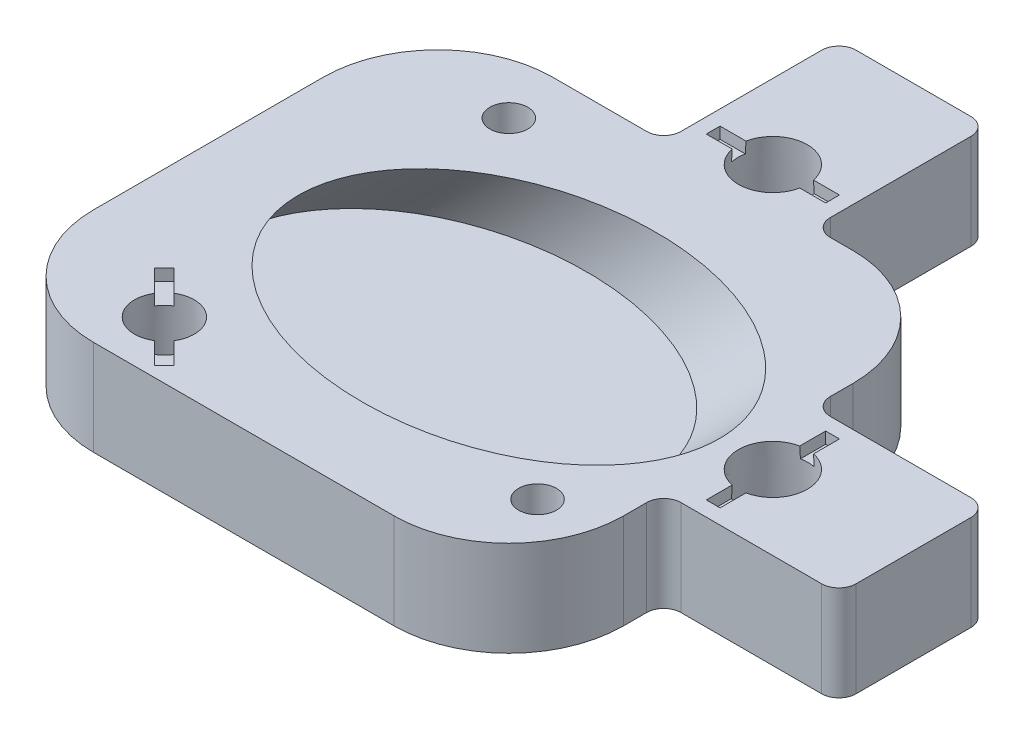
from build123d import *

# Parameters (mm, degrees)
SKETCH2_R           = 3
SKETCH2_R_2         = 2.6
SKETCH2_R_3         = 1.65
BOSS_EXTRUDE1_DEPTH = 8.3
SKETCH19_RX         = 18.35
SKETCH19_RY         = 12.8
CUT_EXTRUDE4_DEPTH  = 8.485281374
FILLET1_R           = 1.5
FILLET2_R           = 10
SKETCH14_W          = 1.2
SKETCH14_H          = 10.4
SKETCH14_W_2        = 10.4
SKETCH14_H_2        = 1.2
CUT_EXTRUDE2_DEPTH  = 1
CUT_EXTRUDE3_DEPTH  = 3.9
CHAMFER1_SIZE       = 0.5
CHAMFER1_SIZE_2     = 8.3
SKETCH20_W          = 7
SKETCH20_H          = 1.2
SKETCH20_W_2        = 1.2
SKETCH20_H_2        = 7
CUT_EXTRUDE5_DEPTH  = 0.4
FILLET3_START       = -35
FILLET3_DEPTH       = 7.75
FILLET3_START_2     = 27.25
FILLET3_2_DEPTH     = 7.75
FILLET3_START_3     = -34.25
FILLET3_3_DEPTH     = 7
FILLET3_4_DEPTH     = 7


with BuildPart() as part:
    # Sketch2 → Boss-Extrude1 (new body)
    with BuildSketch(Plane(origin=(0, 0, 0), x_dir=(1, 0, 0), z_dir=(0, 1, 0))):
        Polygon((20, -20), (20, -6.5), (35.25, -6.5), (35.25, 6.5), (20, 6.5), (20, 20), (6.5, 20), (6.5, 35.25), (-6.5, 35.25), (-6.5, 20), (-26.17, 20), (-26.17, -20), align=None)
        with Locations(Location((23, 0, 0), (0, 0, 90))):
            Circle(SKETCH2_R, mode=Mode.SUBTRACT)
        with Locations(Location((0, 23, 0), (0, 0, 90))):
            Circle(SKETCH2_R, mode=Mode.SUBTRACT)
        with Locations(Location((-15, -15, 0), (0, 0, 90))):
            Circle(SKETCH2_R_2, mode=Mode.SUBTRACT)
        with Locations(Location((-15, 15, 0), (0, 0, 90))):
            Circle(SKETCH2_R_3, mode=Mode.SUBTRACT)
        with Locations(Location((15, -12.5, 0), (0, 0, 90))):
            Circle(SKETCH2_R_3, mode=Mode.SUBTRACT)
    extrude(amount=BOSS_EXTRUDE1_DEPTH)

    # Sketch19 → Cut-Extrude4 (cut, along a direction that is not the sketch's normal)
    with BuildSketch(Plane(origin=(11.72685066, 8.3, 0), x_dir=(0, 0, -1), z_dir=(0, 1, 0))):
        with Locations(Location((0, 11.72685066), (0, 0, 90))):
            Ellipse(SKETCH19_RX, SKETCH19_RY)
    extrude(amount=-CUT_EXTRUDE4_DEPTH, dir=(0.7071067811865488, 0.7071067811865464, 0), mode=Mode.SUBTRACT)

    # Fillet1
    fillet1_edges = [part.edges().sort_by_distance(p)[0] for p in [
        (-6.5, 4.15, -20),
        (-6.5, 4.15, -35.25),
        (6.5, 4.15, -35.25),
        (6.5, 4.15, -20),
        (20, 4.15, -6.5),
        (35.25, 4.15, -6.5),
        (35.25, 4.15, 6.5),
        (20, 4.15, 6.5),
    ]]
    fillet(fillet1_edges, radius=FILLET1_R)

    # Fillet2
    fillet2_edges = [part.edges().sort_by_distance(p)[0] for p in [
        (-26.17, 4.15, 20),
        (-26.17, 4.15, -20),
        (20, 4.15, -20),
        (20, 4.15, 20),
    ]]
    fillet(fillet2_edges, radius=FILLET2_R)

    # Sketch15 → Cut-Revolve1 (revolve, cut)
    with BuildSketch(Plane.XY):
        with BuildLine():
            Line((0, 0), (0, 1.2))
            ThreePointArc((0, 1.2), (1.272792206, 0.88117618), (2.244994432, 0))
            Line((2.244994432, 0), (0, 0))
        make_face()
    revolve(axis=Axis((0, 0, 0), (0, 1, 0)), mode=Mode.SUBTRACT)

    # Sketch14 → Cut-Extrude2 (cut)
    with BuildSketch(Plane(origin=(0, 8.3, 0), x_dir=(1, 0, 0), z_dir=(0, 1, 0))):
        with Locations((23, 0)):
            Rectangle(SKETCH14_W, SKETCH14_H)
        with Locations((0, 23)):
            Rectangle(SKETCH14_W_2, SKETCH14_H_2)
        Polygon((-18.252691193, -10.898780669), (-10.898780669, -18.252691193), (-11.747308807, -19.101219331), (-19.101219331, -11.747308807), align=None)
    extrude(amount=-CUT_EXTRUDE2_DEPTH, mode=Mode.SUBTRACT)

    # Sketch16 → Cut-Extrude3 (cut)
    with BuildSketch(Plane.XZ):
        Polygon((-13.239081679, -11.95), (-16.760918321, -11.95), (-18.521836642, -15), (-16.760918321, -18.05), (-13.239081679, -18.05), (-11.478163358, -15), align=None)
        Polygon((18.05, 14.260918321), (15, 16.021836642), (11.95, 14.260918321), (11.95, 10.739081679), (15, 8.978163358), (18.05, 10.739081679), align=None)
    extrude(amount=-CUT_EXTRUDE3_DEPTH, mode=Mode.SUBTRACT)

    # Chamfer1
    # the kernel refuses this chamfer: 8.3, 0.5 mm, written as the material it takes off along each edge
    with BuildSketch(Plane(origin=(0, 0, -23), x_dir=(0, 0, -1), z_dir=(1, 0, 0))) as chamfer1_piece_1:
        Polygon((3 + CHAMFER1_SIZE, 0), (3, CHAMFER1_SIZE_2), (3, 0), align=None)
    revolve(axis=Axis((0, 0, -23), (0, 1, 0)), mode=Mode.SUBTRACT)
    with BuildSketch(Plane(origin=(23, 0, 0), x_dir=(0, 0, -1), z_dir=(1, 0, 0))) as chamfer1_piece_2:
        Polygon((3 + CHAMFER1_SIZE, 0), (3, CHAMFER1_SIZE_2), (3, 0), align=None)
    revolve(axis=Axis((23, 0, 0), (0, 1, 0)), mode=Mode.SUBTRACT)
    with BuildSketch(Plane(origin=(-15, 0, 15), x_dir=(0, 0, -1), z_dir=(1, 0, 0))) as chamfer1_piece_3:
        Polygon((2.6 + CHAMFER1_SIZE, 0), (2.6, CHAMFER1_SIZE_2), (2.6, 0), align=None)
    revolve(axis=Axis((-15, 0, 15), (0, 1, 0)), mode=Mode.SUBTRACT)

    # Sketch20 → Cut-Extrude5 (cut)
    with BuildSketch(Plane.XZ):
        with Locations((30.75, 0)):
            Rectangle(SKETCH20_W, SKETCH20_H)
        with Locations((0, -30.75)):
            Rectangle(SKETCH20_W_2, SKETCH20_H_2)
    extrude(amount=-CUT_EXTRUDE5_DEPTH, mode=Mode.SUBTRACT)

    # Fillet3: read off the stored shape, not the designer's step
    # Fillet3 outline → Fillet3 (add)
    with BuildSketch(Plane.XY.offset(FILLET3_START)):
        with BuildLine():
            ThreePointArc((-0.6, 0.2), (-0.541421356, 0.341421356), (-0.4, 0.4))
            Line((-0.4, 0.4), (-0.6, 0.4))
            Line((-0.6, 0.4), (-0.6, 0.2))
        make_face()
        with BuildLine():
            Line((0.6, 0.4), (0.4, 0.4))
            ThreePointArc((0.4, 0.4), (0.541421356, 0.341421356), (0.6, 0.2))
            Line((0.6, 0.2), (0.6, 0.4))
        make_face()
    extrude(amount=FILLET3_DEPTH)

    # Fillet3 2 outline → Fillet3 2 (add)
    with BuildSketch(Plane.YZ.offset(FILLET3_START_2)):
        with BuildLine():
            Line((0.4, -0.6), (0.4, -0.4))
            ThreePointArc((0.4, -0.4), (0.341421356, -0.541421356), (0.2, -0.6))
            Line((0.2, -0.6), (0.4, -0.6))
        make_face()
        with BuildLine():
            ThreePointArc((0.2, 0.6), (0.341421356, 0.541421356), (0.4, 0.4))
            Line((0.4, 0.4), (0.4, 0.6))
            Line((0.4, 0.6), (0.2, 0.6))
        make_face()
    extrude(amount=FILLET3_2_DEPTH)

    # Fillet3 3 outline → Fillet3 3 (cut)
    with BuildSketch(Plane.XY.offset(FILLET3_START_3)):
        with BuildLine():
            Line((-0.6, 0), (-0.6, 0.2))
            ThreePointArc((-0.6, 0.2), (-0.658578644, 0.058578644), (-0.8, 0))
            Line((-0.8, 0), (-0.6, 0))
        make_face()
        with BuildLine():
            ThreePointArc((0.8, 0), (0.658578644, 0.058578644), (0.6, 0.2))
            Line((0.6, 0.2), (0.6, 0))
            Line((0.6, 0), (0.8, 0))
        make_face()
    extrude(amount=FILLET3_3_DEPTH, mode=Mode.SUBTRACT)

    # Fillet3 4 outline → Fillet3 4 (cut)
    with BuildSketch(Plane.YZ.offset(FILLET3_START_2)):
        with BuildLine():
            ThreePointArc((0, -0.8), (0.058578644, -0.658578644), (0.2, -0.6))
            Line((0.2, -0.6), (0, -0.6))
            Line((0, -0.6), (0, -0.8))
        make_face()
        with BuildLine():
            Line((0, 0.6), (0.2, 0.6))
            ThreePointArc((0.2, 0.6), (0.058578644, 0.658578644), (0, 0.8))
            Line((0, 0.8), (0, 0.6))
        make_face()
    extrude(amount=FILLET3_4_DEPTH, mode=Mode.SUBTRACT)


solid = part.part
